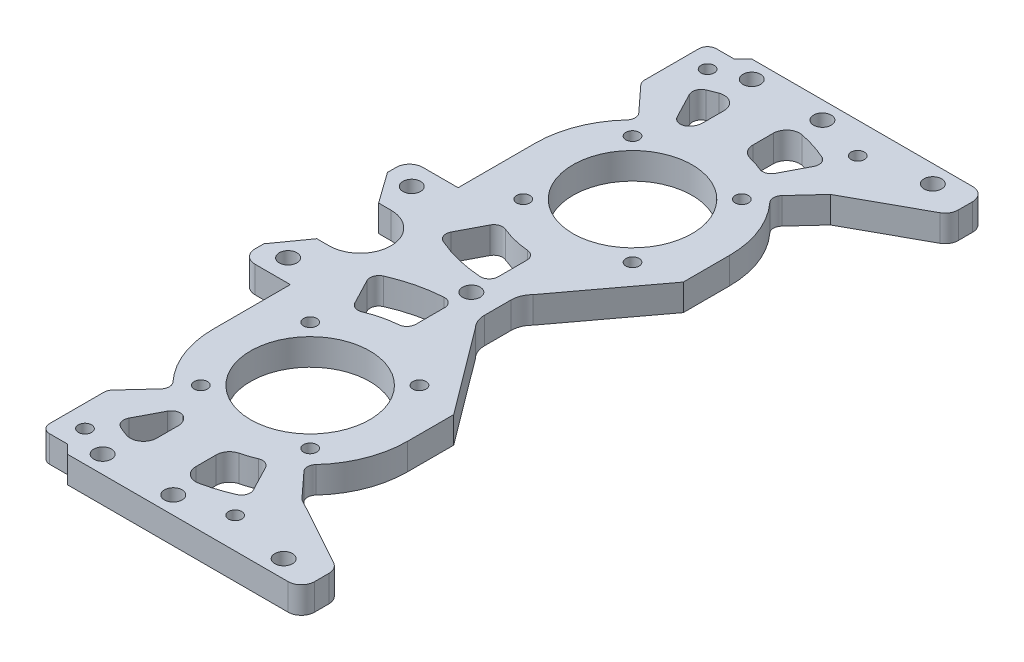
from build123d import *
from build123d.topology import SkipClean

# Parameters (mm, degrees)
SKETCH_1_W           = 44
SKETCH_1_H           = 131
SKETCH_1_R           = 1.6000000000000012
SKETCH_1_R_2         = 1.5999999999999979
SKETCH_1_R_3         = 1.5999999999999954
SKETCH_1_R_4         = 1.5999999999999988
SKETCH_1_H_2         = 9.999999999999986
SKETCH_1_R_5         = 1.600000000000003
SKETCH_1_R_6         = 1.600000000000006
EXTRUDE_1_DEPTH      = 6
SKETCH_2_R           = 2.300000000007249
EXTRUDE_2_DEPTH      = 6
CUT_EXTRUDE_1_DEPTH  = 6
FILLET_1_R           = 5
CUT_EXTRUDE_2_DEPTH  = 6
FILLET_2_R           = 2
SKETCH_4_R           = 1.5999999999999954
SKETCH_4_R_2         = 1.5999999999999985
SKETCH_4_R_3         = 1.5999999999999968
EXTRUDE_3_DEPTH      = 6
SKETCH_5_R           = 1.5000000000000044
EXTRUDE_4_DEPTH      = 6
CUT_EXTRUDE_3_DEPTH  = 6
EXTRUDE_5_DEPTH      = 6
CUT_EXTRUDE_4_DEPTH  = 10
CHAMFER_1_SIZE       = 4
CUT_EXTRUDE_5_DEPTH  = 10
SKETCH_8_R           = 7
CUT_EXTRUDE_6_DEPTH  = 10
SKETCH_11_R          = 2.100000000000002
EXTRUDE_6_DEPTH      = 6
SKETCH_9_R           = 7.499999999999999
CUT_EXTRUDE_7_DEPTH  = 10
CUT_EXTRUDE_8_DEPTH  = 10
CUT_EXTRUDE_START    = -10
CUT_EXTRUDE_9_DEPTH  = 10
FILLET_3_R           = 2
CUT_EXTRUDE_10_DEPTH = 10
SKETCH_14_R          = 2.1
CUT_EXTRUDE_11_DEPTH = 10
EXTRUDE_7_DEPTH      = 6
FILLET_4_R           = 3
FILLET_5_R           = 3
SKETCH_17_R          = 2.1
SKETCH_17_R_2        = 2
SKETCH_17_R_3        = 2.3000000000072487
SKETCH_17_R_4        = 1.9999999999999996
SKETCH_17_R_5        = 1.5999999999999968
SKETCH_17_R_6        = 1.4999999999999991
SKETCH_17_R_7        = 1.5999999999999985
SKETCH_17_R_8        = 1.5000000000000009
SKETCH_17_R_9        = 1.5999999999999974
SKETCH_17_R_10       = 1.6000000000000043
SKETCH_17_R_11       = 2.1000000000000085
SKETCH_17_R_12       = 1.9999999999999936
SKETCH_17_R_13       = 1.600000000000006
SKETCH_17_R_14       = 2.100000000000005
SKETCH_17_R_15       = 2.0999999999999988
SKETCH_17_R_16       = 2.100000000000012
SKETCH_17_R_17       = 1.6000000000000394
SKETCH_17_R_18       = 2.100000000000027
SKETCH_17_R_19       = 1.6000000000000376
SKETCH_17_R_20       = 1.6000000000000276
SKETCH_17_R_21       = 1.6000000000000207
SKETCH_17_R_22       = 1.6000000000000105
SKETCH_17_R_23       = 1.6000000000000045
SKETCH_17_R_24       = 2.3000000000120995
EXTRUDE_8_DEPTH      = 6


with BuildPart() as part:
    # 草图1 → 凸台-拉伸1 (new body)
    # profile 1 of 3: a face of its own
    with BuildSketch(Plane(origin=(0, 0, 0), x_dir=(1, 0, 0), z_dir=(0, 1, 0))):
        Rectangle(SKETCH_1_W, SKETCH_1_H)
        with Locations(Location((-12.374368670764605, -48.874368670764554, 0), (0, 0, 270))):
            Circle(SKETCH_1_R, mode=Mode.SUBTRACT)
        with Locations(Location((-12.374368670764358, -24.125631329235514, 0), (0, 0, 270))):
            Circle(SKETCH_1_R_2, mode=Mode.SUBTRACT)
        with Locations(Location((12.374368670764607, -48.874368670764895, 0), (0, 0, 270))):
            Circle(SKETCH_1_R_3, mode=Mode.SUBTRACT)
        with BuildLine():
            ThreePointArc((13.5, -36.5), (-9.545941546018376, -46.045941546018405), (-3.814e-14, -23))
            ThreePointArc((-3.814e-14, -23), (9.545941546018378, -26.954058453981595), (13.5, -36.5))
        make_face(mode=Mode.SUBTRACT)
        with Locations(Location((12.374368670764863, -24.125631329235695, 0), (0, 0, 270))):
            Circle(SKETCH_1_R_4, mode=Mode.SUBTRACT)
        with Locations(Location((-12.374368670764358, 24.125631329235514, 0), (0, 0, 270))):
            Circle(SKETCH_1_R_2, mode=Mode.SUBTRACT)
        with Locations(Location((-12.374368670764605, 48.874368670764554, 0), (0, 0, 270))):
            Circle(SKETCH_1_R, mode=Mode.SUBTRACT)
        with BuildLine():
            ThreePointArc((13.5, 36.5), (9.545941546018373, 26.954058453981588), (-5.044e-14, 23))
            ThreePointArc((-5.044e-14, 23), (-9.545941546018375, 46.04594154601841), (13.5, 36.5))
        make_face(mode=Mode.SUBTRACT)
        with Locations(Location((12.374368670764863, 24.125631329235695, 0), (0, 0, 270))):
            Circle(SKETCH_1_R_4, mode=Mode.SUBTRACT)
        with Locations(Location((12.374368670764607, 48.874368670764895, 0), (0, 0, 270))):
            Circle(SKETCH_1_R_3, mode=Mode.SUBTRACT)
    # profile 2 of 3: a face of its own
    with BuildSketch(Plane(origin=(0, 0, 0), x_dir=(1, 0, 0), z_dir=(0, 1, 0))):
        with Locations((0, 70.5)):
            Rectangle(SKETCH_1_W, SKETCH_1_H_2)
        with Locations(Location((-16.999999999999996, 70.5, 0), (0, 0, 270))):
            Circle(SKETCH_1_R_5, mode=Mode.SUBTRACT)
        with Locations(Location((16.999999999999996, 70.5, 0), (0, 0, 270))):
            Circle(SKETCH_1_R_6, mode=Mode.SUBTRACT)
    # profile 3 of 3: a face of its own
    with BuildSketch(Plane(origin=(0, 0, 0), x_dir=(1, 0, 0), z_dir=(0, 1, 0))):
        with Locations((0, -70.5)):
            Rectangle(SKETCH_1_W, SKETCH_1_H_2)
        with Locations(Location((-16.999999999999996, -70.5, 0), (0, 0, 270))):
            Circle(SKETCH_1_R_5, mode=Mode.SUBTRACT)
        with Locations(Location((16.999999999999996, -70.5, 0), (0, 0, 270))):
            Circle(SKETCH_1_R_6, mode=Mode.SUBTRACT)
    extrude(amount=EXTRUDE_1_DEPTH)

    # 草图2 → 凸台-拉伸2 (add)
    with BuildSketch(Plane.XZ):
        Polygon((-21.999999999999996, -19.000000000000007), (-22, 0), (-22, 18.999999999999993), (-33, 18.999999999999996), (-32.99999999999999, -19.00000000000001), align=None)
        with Locations(Location((-27.499999999996053, -13.999999999991697, 0), (0, 0, 270))):
            Circle(SKETCH_2_R, mode=Mode.SUBTRACT)
        with Locations(Location((-27.499999999996067, 14.000000000008303, 0), (0, 0, 270))):
            Circle(SKETCH_2_R, mode=Mode.SUBTRACT)
    extrude(amount=-EXTRUDE_2_DEPTH)

    # 草图2<3> → 切除-拉伸1 (cut)
    with BuildSketch(Plane.XZ):
        Polygon((5.999999999999998, 7.999999999999997), (5.999999999999998, -2.35e-15), (22, 0), (22, 8.000000000000002), align=None)
        Polygon((22, 0), (5.9999999999999964, 0), (5.999999999999999, -8.000000000000002), (22, -8.000000000000002), align=None)
    extrude(amount=-CUT_EXTRUDE_1_DEPTH, mode=Mode.SUBTRACT)

    # 圆角1
    fillet_1_edges = [part.edges().sort_by_distance(p)[0] for p in [
        (5.999999999999999, 3, -8.000000000000002),
        (5.999999999999999, 3, 7.999999999999998),
        (22, 3, 8.000000000000002),
        (22, 3, -8.000000000000002),
    ]]
    fillet(fillet_1_edges, radius=FILLET_1_R)

    # 草图3 → 切除-拉伸2 (cut)
    with BuildSketch(Plane.XZ):
        with BuildLine():
            ThreePointArc((-22, 36.5), (-20.144860004859353, 45.34220647715366), (-14.892307692307439, 52.69318287421101))
            Line((-14.892307692307686, 52.69318287421078), (-21.999999999999993, 60.42174742781138))
            Line((-22, 60.42174742781138), (-22, 36.49999999999999))
        make_face()
        with BuildLine():
            Line((-15.05896435190986, 65.30065264274246), (-10.193760484369747, 55.99582640431797))
            ThreePointArc((-10.193760484369832, 55.995826404317924), (1.35e-15, 58.5), (10.19376048436984, 55.995826404317924))
            Line((10.193760484369749, 55.99582640431797), (15.05896435190986, 65.30065264274246))
            ThreePointArc((15.058964351909855, 65.30065264274245), (1.99e-15, 69), (-15.058964351909852, 65.30065264274246))
        make_face()
        with BuildLine():
            Line((22, 60.42174742781138), (14.89230769230769, 52.69318287421078))
            ThreePointArc((14.89230769230745, 52.693182874211), (20.144860004859353, 45.34220647715365), (22, 36.5))
            Line((22, 36.5), (22, 60.42174742781138))
        make_face()
        with BuildLine():
            Line((-22, -36.50000000000003), (-22, -60.4217474278114))
            Line((-21.999999999999982, -60.4217474278114), (-14.892307692307668, -52.693182874210784))
            ThreePointArc((-14.892307692307435, -52.69318287421101), (-20.14486000485934, -45.34220647715367), (-21.999999999999986, -36.500000000000014))
        make_face()
        with BuildLine():
            ThreePointArc((-15.05896435190985, -65.30065264274245), (7.91e-15, -69), (15.058964351909868, -65.30065264274246))
            Line((15.058964351909875, -65.30065264274249), (10.193760484369765, -55.995826404317995))
            ThreePointArc((10.193760484369836, -55.99582640431795), (9.84e-15, -58.500000000000014), (-10.193760484369815, -55.995826404317945))
            Line((-10.193760484369738, -55.995826404317995), (-15.058964351909848, -65.30065264274249))
        make_face()
        with BuildLine():
            Line((14.892307692307709, -52.69318287421079), (22.000000000000014, -60.42174742781138))
            Line((22, -60.42174742781138), (22, -36.500000000000014))
            ThreePointArc((22.000000000000014, -36.50000000000002), (20.144860004859343, -45.34220647715373), (14.89230769230737, -52.6931828742111))
        make_face()
    extrude(amount=-CUT_EXTRUDE_2_DEPTH, mode=Mode.SUBTRACT)

    # 圆角2
    fillet_2_edges = [part.edges().sort_by_distance(p)[0] for p in [
        (14.892307692307567, 3, 52.69318287421088),
        (22, 3, 60.42174742781138),
        (10.193760484369793, 3, 55.995826404317945),
        (-10.19376048436979, 3, 55.995826404317945),
        (-15.058964351909859, 3, 65.30065264274246),
        (15.058964351909859, 3, 65.30065264274245),
        (15.058964351909871, 3, -65.30065264274248),
        (-15.058964351909848, 3, -65.30065264274248),
        (-10.193760484369776, 3, -55.99582640431797),
        (10.1937604843698, 3, -55.995826404317974),
        (-14.892307692307549, 3, -52.69318287421089),
        (-21.999999999999993, 3, -60.4217474278114),
        (22.000000000000007, 3, -60.42174742781138),
        (14.892307692307536, 3, -52.69318287421095),
        (-14.892307692307563, 3, 52.6931828742109),
        (-21.999999999999996, 3, 60.42174742781138),
        (-22, 3, -75.49999999999999),
        (22, 3, -75.49999999999999),
        (22, 3, 75.49999999999999),
        (-22, 3, 75.49999999999999),
    ]]
    fillet(fillet_2_edges, radius=FILLET_2_R)

    # 草图4 → 凸台-拉伸3 (add)
    with BuildSketch(Plane.XZ):
        Polygon((-32.99999999999999, -30), (-32.99999999999999, 29.999999999999993), (-55, 29.999999999999993), (-55, -30.000000000000007), align=None)
        with Locations(Location((-37.99999999999999, 24.999999999999993, 0), (0, 0, 270))):
            Circle(SKETCH_4_R, mode=Mode.SUBTRACT)
        with Locations(Location((-50, -25.000000000000007, 0), (0, 0, 270))):
            Circle(SKETCH_4_R_2, mode=Mode.SUBTRACT)
        with Locations(Location((-38.00000000000001, -25.000000000000007, 0), (0, 0, 270))):
            Circle(SKETCH_4_R_3, mode=Mode.SUBTRACT)
        with Locations(Location((-50, 24.999999999999993, 0), (0, 0, 270))):
            Circle(SKETCH_4_R_2, mode=Mode.SUBTRACT)
    extrude(amount=-EXTRUDE_3_DEPTH)

    # 草图5 → 凸台-拉伸4 (add)
    with BuildSketch(Plane.XZ):
        Polygon((-55, 14.999999999999984), (-65.19999999998896, 14.999999999999984), (-65.19999999998896, -15.000000000000009), (-55, -15.00000000000001), align=None)
        with Locations(Location((-61.19999999998895, -10.000000000000016, 0), (0, 0, 270))):
            Circle(SKETCH_5_R, mode=Mode.SUBTRACT)
        with Locations(Location((-61.19999999998895, 9.999999999999991, 0), (0, 0, 270))):
            Circle(SKETCH_5_R, mode=Mode.SUBTRACT)
    extrude(amount=-EXTRUDE_4_DEPTH)

    # 草图5<4> → 切除-拉伸3 (cut)
    with BuildSketch(Plane.XZ):
        with BuildLine():
            ThreePointArc((-33.99999999998895, 9.999999999999986), (-33.56066017176877, 8.939339828220156), (-32.49999999998893, 8.499999999999986))
            Line((-32.49999999998895, 8.499999999999986), (-32.49999999998895, 9.999999999999986))
            Line((-32.49999999998895, 9.999999999999986), (-33.99999999998895, 9.999999999999986))
        make_face()
        with BuildLine():
            Line((-32.49999999998895, 9.999999999999986), (-32.49999999998895, 8.499999999999986))
            ThreePointArc((-32.49999999998893, 8.499999999999986), (-31.43933982820912, 8.93933982822017), (-30.99999999998895, 9.999999999999986))
            ThreePointArc((-30.99999999998895, 9.999999999999986), (-32.49999999998895, 11.499999999999986), (-33.99999999998895, 9.999999999999986))
            Line((-33.99999999998895, 9.999999999999986), (-32.49999999998895, 9.999999999999986))
        make_face()
        with BuildLine():
            ThreePointArc((-30.999999999988944, -10.000000000000012), (-31.439339828209114, -8.939339828220199), (-32.49999999998892, -8.50000000000001))
            Line((-32.499999999988944, -8.50000000000001), (-32.499999999988944, -10.000000000000014))
            Line((-32.499999999988944, -10.000000000000012), (-33.999999999988944, -10.000000000000012))
            ThreePointArc((-33.999999999988944, -10.000000000000012), (-32.499999999988944, -11.500000000000014), (-30.999999999988944, -10.000000000000012))
        make_face()
        with BuildLine():
            Line((-32.499999999988944, -10.000000000000014), (-32.499999999988944, -8.50000000000001))
            ThreePointArc((-32.49999999998892, -8.50000000000001), (-33.56066017176876, -8.939339828220183), (-33.999999999988944, -10.000000000000012))
            Line((-33.999999999988944, -10.000000000000012), (-32.499999999988944, -10.000000000000012))
        make_face()
    extrude(amount=-CUT_EXTRUDE_3_DEPTH, mode=Mode.SUBTRACT)

    # 草图6 → 凸台-拉伸5 (add)
    with BuildSketch(Plane(origin=(0, 6, 0), x_dir=(1, 0, 0), z_dir=(0, 1, 0))):
        with BuildLine():
            Line((-12, 77.49999999999999), (-12, 75.49999999999999))
            Line((-12, 75.49999999999999), (-10.640312423743215, 75.49999999999999))
            ThreePointArc((-10.640312423743223, 75.50000000000004), (-9.999999999999943, 75.60000000000002), (-9.35968757625667, 75.5))
            Line((-9.359687576256672, 75.49999999999999), (5.359687576256704, 75.49999999999999))
            ThreePointArc((5.359687576256699, 75.50000000000001), (6.000000000000013, 75.60000000000002), (6.640312423743326, 75.5))
            Line((6.640312423743325, 75.49999999999999), (12, 75.49999999999999))
            Line((12, 75.49999999999999), (12, 77.49999999999999))
            Line((12, 77.49999999999999), (-12, 77.49999999999999))
        make_face()
        with BuildLine():
            Line((11.999999999999973, -77.49999999999999), (11.999999999999973, -75.49999999999999))
            Line((11.999999999999972, -75.49999999999999), (6.6403124237433, -75.49999999999999))
            ThreePointArc((6.640312423743301, -75.5), (5.999999999999985, -75.60000000000002), (5.35968757625667, -75.50000000000001))
            Line((5.359687576256675, -75.49999999999999), (-9.359687576256718, -75.49999999999999))
            ThreePointArc((-9.359687576256716, -75.5), (-10.000000000000162, -75.60000000000002), (-10.640312423743598, -75.49999999999993))
            Line((-10.640312423743605, -75.49999999999999), (-12.000000000000043, -75.49999999999999))
            Line((-12.000000000000043, -75.49999999999999), (-12.000000000000043, -77.49999999999999))
            Line((-12.000000000000043, -77.49999999999999), (11.999999999999972, -77.49999999999999))
        make_face()
    extrude(amount=-EXTRUDE_5_DEPTH)

    # 草图6<3> → 切除-拉伸4 (cut)
    with SkipClean():  # the faces are left unmerged after this step: merging them gives an invalid solid
        with BuildSketch(Plane(origin=(0, 6, 0), x_dir=(1, 0, 0), z_dir=(0, 1, 0))):
            with BuildLine():
                ThreePointArc((-10.640312423743598, -75.49999999999993), (-10.000000000000162, -75.60000000000002), (-9.359687576256716, -75.5))
                Line((-9.359687576256718, -75.49999999999999), (-10.640312423743605, -75.49999999999999))
            make_face()
            with BuildLine():
                Line((-10.640312423743605, -75.49999999999999), (-9.359687576256718, -75.49999999999999))
                ThreePointArc((-9.359687576256716, -75.5), (-8.303731140140114, -74.73801129036433), (-7.900000000000038, -73.50000000000001))
                ThreePointArc((-7.900000000000038, -73.50000000000001), (-11.23801129036426, -71.80373114014002), (-10.640312423743598, -75.49999999999993))
            make_face()
            with BuildLine():
                ThreePointArc((5.35968757625667, -75.50000000000001), (5.999999999999985, -75.60000000000002), (6.640312423743301, -75.5))
                Line((6.6403124237433, -75.49999999999999), (5.359687576256675, -75.49999999999999))
            make_face()
            with BuildLine():
                Line((5.359687576256675, -75.49999999999999), (6.6403124237433, -75.49999999999999))
                ThreePointArc((6.640312423743301, -75.5), (7.696268859859903, -74.73801129036433), (8.09999999999998, -73.50000000000001))
                ThreePointArc((8.09999999999998, -73.50000000000001), (4.76198870963565, -71.80373114014009), (5.35968757625667, -75.50000000000001))
            make_face()
            with BuildLine():
                ThreePointArc((6.640312423743326, 75.5), (6.000000000000013, 75.60000000000002), (5.359687576256699, 75.50000000000001))
                Line((5.359687576256704, 75.49999999999999), (6.640312423743325, 75.49999999999999))
            make_face()
            with BuildLine():
                Line((6.640312423743325, 75.49999999999999), (5.359687576256704, 75.49999999999999))
                ThreePointArc((5.359687576256699, 75.50000000000001), (4.761988709635677, 71.80373114014009), (8.100000000000007, 73.50000000000001))
                ThreePointArc((8.100000000000007, 73.50000000000001), (7.696268859859931, 74.73801129036433), (6.640312423743326, 75.5))
            make_face()
            with BuildLine():
                ThreePointArc((-9.35968757625667, 75.5), (-9.999999999999943, 75.60000000000002), (-10.640312423743223, 75.50000000000004))
                Line((-10.640312423743215, 75.49999999999999), (-9.359687576256672, 75.49999999999999))
            make_face()
            with BuildLine():
                Line((-9.359687576256672, 75.49999999999999), (-10.640312423743215, 75.49999999999999))
                ThreePointArc((-10.640312423743223, 75.50000000000004), (-11.238011290364359, 71.80373114014012), (-7.899999999999995, 73.50000000000001))
                ThreePointArc((-7.899999999999995, 73.50000000000001), (-8.30373114014007, 74.73801129036433), (-9.35968757625667, 75.5))
            make_face()
        extrude(amount=-CUT_EXTRUDE_4_DEPTH, mode=Mode.SUBTRACT)

    # 倒角1
    # the kernel refuses this chamfer: 4 mm, written as the material it adds along each edge
    with BuildSketch(Plane(origin=(-12, 6, -75.49999999999999), x_dir=(-1, 0, 0), z_dir=(0, -1, 0))) as chamfer_1_piece_1_section:
        Polygon((CHAMFER_1_SIZE, 0), (0, CHAMFER_1_SIZE), (0, 0), align=None)
    chamfer_1_piece_1 = extrude(amount=6, mode=Mode.PRIVATE)
    chamfer_1_piece_1 = split(chamfer_1_piece_1, bisect_by=Plane(origin=(-12, 6, -77.49999999999999), z_dir=(0, 0, 1)), keep=Keep.TOP, mode=Mode.PRIVATE)
    add(chamfer_1_piece_1)
    with BuildSketch(Plane(origin=(12, 6, -75.49999999999999), x_dir=(0, 0, -1), z_dir=(0, -1, 0))) as chamfer_1_piece_2_section:
        Polygon((CHAMFER_1_SIZE, 0), (0, CHAMFER_1_SIZE), (0, 0), align=None)
    chamfer_1_piece_2 = extrude(amount=6, mode=Mode.PRIVATE)
    chamfer_1_piece_2 = split(chamfer_1_piece_2, bisect_by=Plane(origin=(12, 6, -77.49999999999999), z_dir=(0, 0, 1)), keep=Keep.TOP, mode=Mode.PRIVATE)
    add(chamfer_1_piece_2)
    with BuildSketch(Plane(origin=(11.999999999999972, 6, 75.49999999999999), x_dir=(4.4e-16, 0, 1), z_dir=(0, -1, 0))) as chamfer_1_piece_3_section:
        Polygon((CHAMFER_1_SIZE, 0), (1.78e-15, -CHAMFER_1_SIZE), (0, 0), align=None)
    chamfer_1_piece_3 = extrude(amount=6, mode=Mode.PRIVATE)
    chamfer_1_piece_3 = split(chamfer_1_piece_3, bisect_by=Plane(origin=(11.999999999999972, 6, 77.49999999999999), z_dir=(0, 0, -1)), keep=Keep.TOP, mode=Mode.PRIVATE)
    add(chamfer_1_piece_3)
    with BuildSketch(Plane(origin=(-12.000000000000043, 6, 75.49999999999999), x_dir=(-1, 0, 0), z_dir=(0, -1, 0))) as chamfer_1_piece_4_section:
        Polygon((CHAMFER_1_SIZE, 0), (0, -CHAMFER_1_SIZE), (0, 0), align=None)
    chamfer_1_piece_4 = extrude(amount=6, mode=Mode.PRIVATE)
    chamfer_1_piece_4 = split(chamfer_1_piece_4, bisect_by=Plane(origin=(-12.000000000000043, 6, 77.49999999999999), z_dir=(0, 0, -1)), keep=Keep.TOP, mode=Mode.PRIVATE)
    add(chamfer_1_piece_4)

    # 草图7 → 切除-拉伸5 (cut)
    with BuildSketch(Plane(origin=(0, 6, 0), x_dir=(1, 0, 0), z_dir=(0, 1, 0))):
        Polygon((-25.19999999998896, 7.000000000000005), (-65.19999999998896, 7), (-65.19999999998896, -7), (-25.19999999998896, -6.999999999999996), align=None)
    extrude(amount=-CUT_EXTRUDE_5_DEPTH, mode=Mode.SUBTRACT)

    # 草图8 → 切除-拉伸6 (cut)
    with BuildSketch(Plane(origin=(0, 6, 0), x_dir=(1, 0, 0), z_dir=(0, 1, 0))):
        with Locations((-25.19999999998896, 4.34e-15)):
            Circle(SKETCH_8_R)
    extrude(amount=-CUT_EXTRUDE_6_DEPTH, mode=Mode.SUBTRACT)

    # 草图11 → 凸台-拉伸6 (add)
    # profile 1 of 2: a face of its own
    with BuildSketch(Plane(origin=(0, 6, 0), x_dir=(1, 0, 0), z_dir=(0, 1, 0))):
        with BuildLine():
            Line((21.47210753401916, 59.847742416891464), (39.00000000000001, 69.49999999999997))
            Line((39.00000000000001, 69.49999999999997), (39.00000000000001, 77.49999999999999))
            Line((39.00000000000001, 77.49999999999999), (14.00000000000005, 77.49999999999999))
            Line((14.00000000000005, 77.49999999999999), (14.00000000000005, 69.5))
            Line((14.00000000000005, 69.5), (15.751000400320294, 69.5))
            ThreePointArc((15.751000400320303, 69.50000000000001), (16.999999999999975, 72.10000000000001), (18.248999599679713, 69.50000000000004))
            Line((18.248999599679728, 69.5), (22, 69.49999999999999))
            Line((22, 69.5), (22, 61.201588570737606))
            ThreePointArc((22, 61.201588570737606), (21.8633592069215, 60.47502648393371), (21.47210753401916, 59.847742416891464))
        make_face()
        with Locations(Location((31.000000000000004, 73.50000000000001, 0), (0, 0, 270))):
            Circle(SKETCH_11_R, mode=Mode.SUBTRACT)
    # profile 2 of 2: a face of its own
    with BuildSketch(Plane(origin=(0, 6, 0), x_dir=(1, 0, 0), z_dir=(0, 1, 0))):
        with BuildLine():
            Line((21.999999999999993, -61.201588570737606), (21.999999999999986, -69.5))
            Line((21.999999999999986, -69.49999999999999), (18.248999599679728, -69.5))
            ThreePointArc((18.248999599679713, -69.50000000000004), (16.999999999999982, -72.10000000000001), (15.751000400320294, -69.50000000000001))
            Line((15.751000400320292, -69.5), (14.00000000000004, -69.5))
            Line((14.00000000000004, -69.5), (14.000000000000036, -77.49999999999999))
            Line((14.000000000000036, -77.49999999999999), (39.00000000000001, -77.49999999999999))
            Line((39.00000000000001, -77.49999999999999), (39.00000000000001, -69.49999999999997))
            Line((39.00000000000001, -69.49999999999997), (21.47210753401915, -59.847742416891464))
            ThreePointArc((21.47210753401915, -59.847742416891464), (21.86335920692149, -60.47502648393371), (21.999999999999993, -61.201588570737606))
        make_face()
        with Locations(Location((30.99999999999999, -73.50000000000001, 0), (0, 0, 270))):
            Circle(SKETCH_11_R, mode=Mode.SUBTRACT)
    extrude(amount=-EXTRUDE_6_DEPTH)

    # 草图9 → 切除-拉伸7 (cut)
    with BuildSketch(Plane(origin=(0, 6, 0), x_dir=(1, 0, 0), z_dir=(0, 1, 0))):
        with Locations((22, -8)):
            Circle(SKETCH_9_R)
        with Locations((22, 8)):
            Circle(SKETCH_9_R)
    extrude(amount=-CUT_EXTRUDE_7_DEPTH, mode=Mode.SUBTRACT)

    # 草图10 → 切除-拉伸8 (cut)
    with BuildSketch(Plane(origin=(0, 6, 0), x_dir=(1, 0, 0), z_dir=(0, 1, 0))):
        Polygon((-65.19999999998896, -29.999999999999996), (-65.19999999998896, 29.999999999999996), (-32.99999999999999, 30), (-32.99999999999999, -29.999999999999996), align=None)
        Polygon((-32.99999999999999, 14.000000000000004), (-32.99999999999999, -13.999999999999996), (-27.99999999999999, -6.999999999999996), (-27.999999999999993, 7.000000000000005), align=None)
    extrude(amount=-CUT_EXTRUDE_8_DEPTH, mode=Mode.SUBTRACT)

    # 草图12 → 切除-拉伸9 (cut)
    with BuildSketch(Plane(origin=(0, 6, 0), x_dir=(1, 0, 0), z_dir=(0, 1, 0)).offset(CUT_EXTRUDE_START)):
        with BuildLine():
            Line((9.7e-16, 3.9999999999999964), (4.3e-16, 14.500000000000004))
            ThreePointArc((3.5438e-13, 14.500000000000004), (-4.352879350461469, 14.93492542650673), (-8.533651618374918, 16.222505330879585))
            ThreePointArc((-8.53365161837492, 16.222505330879585), (-9.986468243012771, 16.261018674333567), (-11.081785984074282, 15.305802223174965))
            Line((-11.081785984074282, 15.305802223174965), (-14.101842334122514, 9.529867579421293))
            ThreePointArc((-14.101842334122514, 9.529867579421293), (-14.217370431844785, 7.942916378571444), (-13.137985920442516, 6.7738612336843484))
            ThreePointArc((-13.137985920442516, 6.77386123368435), (-6.713810024670839, 4.7010258820724005), (1.78e-15, 4))
        make_face()
        with BuildLine():
            Line((-14.101842334122516, -9.529867579421285), (-11.081785984074285, -15.305802223174958))
            ThreePointArc((-11.081785984074287, -15.305802223174958), (-9.986468243012775, -16.26101867433356), (-8.533651618374924, -16.222505330879578))
            ThreePointArc((-8.533651618374922, -16.22250533087958), (-4.352879350461469, -14.934925426506727), (3.5483e-13, -14.500000000000004))
            Line((-8.9e-16, -14.500000000000004), (-1.99e-15, -3.9999999999999893))
            ThreePointArc((0, -3.999999999999993), (-6.713810024670839, -4.701025882072393), (-13.137985920442517, -6.773861233684343))
            ThreePointArc((-13.137985920442517, -6.773861233684341), (-14.217370431844785, -7.942916378571437), (-14.101842334122516, -9.529867579421285))
        make_face()
    extrude(amount=CUT_EXTRUDE_9_DEPTH, mode=Mode.SUBTRACT)

    # 圆角3
    fillet_3_edges = [part.edges().sort_by_distance(p)[0] for p in [
        (1.7741e-13, 3, -14.500000000000002),
        (9.3e-16, 3, -3.9999999999999982),
        (-1e-15, 3, 3.999999999999991),
        (1.7797e-13, 3, 14.500000000000004),
    ]]
    fillet(fillet_3_edges, radius=FILLET_3_R)

    # 草图13 → 切除-拉伸10 (cut)
    with BuildSketch(Plane(origin=(0, 6, 0), x_dir=(1, 0, 0), z_dir=(0, 1, 0))):
        with BuildLine():
            Line((7.464466094067261, 6.5355339059327395), (22, 26.000000000000007))
            Line((22, 26.000000000000007), (22, -26))
            Line((22, -26), (7.4644660940672605, -6.535533905932737))
            ThreePointArc((7.4644660940672605, -6.535533905932737), (6.380602337443563, -4.913417161825446), (5.999999999999998, -2.999999999999999))
            Line((5.999999999999998, -2.999999999999999), (5.999999999999998, 3.0000000000000018))
            ThreePointArc((5.999999999999998, 3.0000000000000018), (6.380602337443565, 4.913417161825452), (7.464466094067261, 6.5355339059327395))
        make_face()
    extrude(amount=-CUT_EXTRUDE_10_DEPTH, mode=Mode.SUBTRACT)

    # 草图14 → 切除-拉伸11 (cut)
    with BuildSketch(Plane.XZ):
        with Locations(Location((0, 0, 0), (0, 0, 270))):
            Circle(SKETCH_14_R)
    extrude(amount=-CUT_EXTRUDE_11_DEPTH, mode=Mode.SUBTRACT)

    # 草图16 → 凸台-拉伸7 (add)
    with BuildSketch(Plane(origin=(0, 6, 0), x_dir=(1, 0, 0), z_dir=(0, 1, 0))):
        Polygon((3.000000000000001, 77.49999999999999), (-7.000000000000001, 77.49999999999999), (-6.999999999999998, 55.499999999999986), (3.000000000000004, 55.499999999999986), align=None)
        Polygon((-7.000000000000037, -77.49999999999999), (-7.000000000000025, -55.499999999999986), (2.999999999999978, -55.499999999999986), (2.9999999999999636, -77.49999999999999), align=None)
    extrude(amount=-EXTRUDE_7_DEPTH)

    # 圆角4
    # the kernel refuses this fillet: 3 mm, written as the material it adds along each edge
    with BuildSketch(Plane(origin=(3.000000000000002, 6, -68.86124225056881), x_dir=(0.9889750159305115, 0, 0.14808246981072612), z_dir=(0, -1, 0))) as fillet_4_piece_1:
        with BuildLine():
            CenterArc((3.481934557248917, 2.9952653058202774), FILLET_4_R, 171.48418080684652, 101.73525747445501)
            Line((0.5150095094573806, 3.439512715252442), (0, 0))
            ThreePointArc((0, 0), (1.8252076308159657, -0.05129252028039473), (3.650415261631931, 1e-17))
        make_face()
    extrude(amount=6)
    with BuildSketch(Plane(origin=(-6.999999999999998, 6, -68.2372021451167), x_dir=(-4.5e-16, 0, 1), z_dir=(0, -1, 0))) as fillet_4_piece_2:
        with BuildLine():
            CenterArc((3.983823972360882, 3), FILLET_4_R, 160.18507185149306, 109.81492814850691)
            ThreePointArc((1.1614465310636763, 4.016949152542375), (0.5160531224182288, 2.0271730736955695), (0, 0))
            Line((0, 0), (3.983823972360881, 0))
        make_face()
    extrude(amount=6)
    with BuildSketch(Plane(origin=(3.0000000000000036, 6, -58.29449471770339), x_dir=(0, 0, -1), z_dir=(0, -1, 0))) as fillet_4_piece_3:
        with BuildLine():
            CenterArc((2.474827481319835, 3), FILLET_4_R, 193.88654036262892, 76.11345963737108)
            ThreePointArc((-0.43749118256295105, 2.280000000000003), (-0.18864943531983158, 1.14577491353608), (0, 0))
            Line((0, 0), (2.474827481319835, 0))
        make_face()
    extrude(amount=6)
    with BuildSketch(Plane(origin=(-6.999999999999997, 6, -57.35665361461422), x_dir=(-0.9355165636527262, 0, 0.3532828316397426), z_dir=(0, -1, 0))) as fillet_4_piece_4:
        with BuildLine():
            CenterArc((2.086538932486849, 2.966485133421304), FILLET_4_R, 200.68823974678753, 60.73939049658128)
            Line((-0.7200107584713293, 1.906636638502076), (0, 0))
            ThreePointArc((0, 0), (0.8196817020487687, 0.01527525968270757), (1.6393634040973872, 5e-17))
        make_face()
    extrude(amount=6)
    with BuildSketch(Plane(origin=(-7.000000000000026, 6, 57.356653614614196), x_dir=(-4.4e-16, 0, 1), z_dir=(0, -1, 0))) as fillet_4_piece_5:
        with BuildLine():
            CenterArc((2.0380575957497142, 3), FILLET_4_R, 209.26060950341883, 60.73939049658111)
            ThreePointArc((-0.5791589454860493, 1.5336516183792164), (-0.2752892142958029, 0.772222296184416), (0, 0))
            Line((0, 0), (2.038057595749713, 0))
        make_face()
    extrude(amount=6)
    with BuildSketch(Plane(origin=(2.999999999999976, 6, 58.29449471770337), x_dir=(0.9820838764719788, 0, -0.18844431425164032), z_dir=(0, -1, 0))) as fillet_4_piece_6:
        with BuildLine():
            CenterArc((2.4798844618075044, 2.995821109208881), FILLET_4_R, 190.86201006285665, 76.11345963737108)
            Line((-0.4663671676084318, 2.43048816645396), (0, 0))
            ThreePointArc((0, 0), (1.160796982122668, 0.03064519913488969), (2.3215939642453285, 2e-17))
        make_face()
    extrude(amount=6)
    with BuildSketch(Plane(origin=(-7.000000000000032, 6, 68.2372021451167), x_dir=(-0.9606507391599529, 0, -0.2777591714983255), z_dir=(0, -1, 0))) as fillet_4_piece_7:
        with BuildLine():
            CenterArc((3.9884958634379744, 2.9937859292366316), FILLET_4_R, 163.87348951821895, 109.81492814850691)
            Line((1.1065436459581155, 3.8270634437316082), (0, 0))
            ThreePointArc((0, 0), (2.0907437993828095, -0.06731909993650714), (4.181487598765617, 8e-17))
        make_face()
    extrude(amount=6)
    with BuildSketch(Plane(origin=(2.9999999999999694, 6, 68.86124225056881), x_dir=(6.4e-16, 0, -1), z_dir=(0, -1, 0))) as fillet_4_piece_8:
        with BuildLine():
            CenterArc((3.477856022496441, 3), FILLET_4_R, 168.26474252554453, 101.73525747445541)
            ThreePointArc((0.5405625077772266, 3.6101694915254274), (0.21955423282719383, 1.8126802688486559), (0, 0))
            Line((0, 0), (3.4778560224964394, 0))
        make_face()
    extrude(amount=6)
    # the kernel refuses this fillet: 3 mm, written as the material it takes off along each edge
    with BuildSketch(Plane(origin=(39.00000000000001, 10.431893605808988, 69.49999999999997), x_dir=(0, 0, 1), z_dir=(0, -1, 0))) as fillet_4_2_piece_1:
        with BuildLine():
            CenterArc((FILLET_4_R * 0.590919147441, FILLET_4_R), FILLET_4_R, 208.84069211093257, 61.15930788906746)
            Line((-FILLET_4_R * 0.285045164716, FILLET_4_R * 0.517624084529), (0, 0))
            Line((0, 0), (FILLET_4_R * 0.590919147441, 0))
        make_face()
    extrude(amount=14.863787211617975, mode=Mode.SUBTRACT)
    with BuildSketch(Plane(origin=(39.00000000000001, 13.5, 77.49999999999999), x_dir=(-1, 0, 4.74e-15), z_dir=(0, -1, 0))) as fillet_4_2_piece_2:
        with BuildLine():
            CenterArc((FILLET_4_R, FILLET_4_R), FILLET_4_R, 180, 90.00000000000028)
            Line((-1.421e-14, FILLET_4_R), (0, 0))
            Line((0, 0), (FILLET_4_R, 0))
        make_face()
    extrude(amount=21, mode=Mode.SUBTRACT)
    with BuildSketch(Plane(origin=(39.00000000000001, 13.5, -77.49999999999999), x_dir=(0, 0, 1), z_dir=(0, -1, 0))) as fillet_4_2_piece_3:
        with BuildLine():
            CenterArc((FILLET_4_R, FILLET_4_R), FILLET_4_R, 180, 90)
            Line((0, FILLET_4_R), (0, 0))
            Line((0, 0), (FILLET_4_R, 0))
        make_face()
    extrude(amount=21, mode=Mode.SUBTRACT)
    with BuildSketch(Plane(origin=(39.00000000000001, 10.431893605808988, -69.49999999999997), x_dir=(-0.8759643121574832, 0, 0.48237591547098146), z_dir=(0, -1, 0))) as fillet_4_2_piece_4:
        with BuildLine():
            CenterArc((FILLET_4_R * 0.590919147441, FILLET_4_R), FILLET_4_R, 208.8406921109323, 61.15930788906752)
            Line((-FILLET_4_R * 0.285045164716, FILLET_4_R * 0.517624084529), (0, 0))
            Line((0, 0), (FILLET_4_R * 0.590919147441, 0))
        make_face()
    extrude(amount=14.863787211617975, mode=Mode.SUBTRACT)

    # 圆角5
    fillet_5_edges = [part.edges().sort_by_distance(p)[0] for p in [
        (-33, 3, 18.999999999999996),
        (-32.99999999999999, 3, -19.00000000000001),
    ]]
    fillet(fillet_5_edges, radius=FILLET_5_R)

    # 草图17 → 凸台-拉伸8 (add)
    # profile 1 of 21: a face of its own
    with BuildSketch(Plane.XZ):
        Circle(SKETCH_17_R)
        with Locations(Location((0, 0, 0), (0, 0, 270))):
            Circle(SKETCH_17_R_2, mode=Mode.SUBTRACT)
    # profile 2 of 21: a face of its own
    with BuildSketch(Plane.XZ):
        with Locations((-27.499999999996067, 14.000000000008303)):
            Circle(SKETCH_17_R_3)
        with Locations(Location((-27.499999999996067, 14.000000000008303, 0), (0, 0, 270))):
            Circle(SKETCH_17_R_4, mode=Mode.SUBTRACT)
    # profile 3 of 21: a face of its own
    with BuildSketch(Plane.XZ):
        with Locations((12.374368670764863, 24.125631329235695)):
            Circle(SKETCH_17_R_5)
        with Locations(Location((12.374368670764852, 24.125631329235702, 0), (0, 0, 270))):
            Circle(SKETCH_17_R_6, mode=Mode.SUBTRACT)
    # profile 4 of 21: a face of its own
    with BuildSketch(Plane.XZ):
        with Locations((-12.374368670764358, 24.125631329235514)):
            Circle(SKETCH_17_R_7)
        with Locations(Location((-12.374368670764367, 24.12563132923551, 0), (0, 0, 270))):
            Circle(SKETCH_17_R_8, mode=Mode.SUBTRACT)
    # profile 5 of 21: a face of its own
    with BuildSketch(Plane.XZ):
        with Locations((12.374368670764607, 48.874368670764895)):
            Circle(SKETCH_17_R_9)
        with Locations(Location((12.374368670764582, 48.874368670764895, 0), (0, 0, 270))):
            Circle(SKETCH_17_R_8, mode=Mode.SUBTRACT)
    # profile 6 of 21: a face of its own
    with BuildSketch(Plane.XZ):
        with Locations((-12.374368670764605, 48.874368670764554)):
            Circle(SKETCH_17_R_10)
        with Locations(Location((-12.37436867076463, 48.874368670764554, 0), (0, 0, 270))):
            Circle(SKETCH_17_R_6, mode=Mode.SUBTRACT)
    # profile 7 of 21: a face of its own
    with BuildSketch(Plane.XZ):
        with Locations((-16.999999999999996, 70.5)):
            Circle(SKETCH_17_R_10)
        with Locations(Location((-17.000000000000032, 70.5, 0), (0, 0, 270))):
            Circle(SKETCH_17_R_8, mode=Mode.SUBTRACT)
    # profile 8 of 21: a face of its own
    with BuildSketch(Plane.XZ):
        with Locations((30.99999999999999, 73.50000000000001)):
            Circle(SKETCH_17_R_11)
        with Locations(Location((30.999999999999968, 73.50000000000004, 0), (0, 0, 270))):
            Circle(SKETCH_17_R_12, mode=Mode.SUBTRACT)
    # profile 9 of 21: a face of its own
    with BuildSketch(Plane.XZ):
        with Locations((16.999999999999996, 70.5)):
            Circle(SKETCH_17_R_13)
        with Locations(Location((16.999999999999964, 70.5, 0), (0, 0, 270))):
            Circle(SKETCH_17_R_8, mode=Mode.SUBTRACT)
    # profile 10 of 21: a face of its own
    with BuildSketch(Plane.XZ):
        with Locations((5.999999999999974, 73.50000000000001)):
            Circle(SKETCH_17_R_14)
        with Locations(Location((5.999999999999967, 73.50000000000001, 0), (0, 0, 270))):
            Circle(SKETCH_17_R_2, mode=Mode.SUBTRACT)
    # profile 11 of 21: a face of its own
    with BuildSketch(Plane.XZ):
        with Locations((-10.000000000000043, 73.50000000000001)):
            Circle(SKETCH_17_R_14)
        with Locations(Location((-10.000000000000036, 73.50000000000001, 0), (0, 0, 270))):
            Circle(SKETCH_17_R_2, mode=Mode.SUBTRACT)
    # profile 12 of 21: a face of its own
    with BuildSketch(Plane.XZ):
        with Locations((-10, -73.50000000000001)):
            Circle(SKETCH_17_R_15)
        with Locations(Location((-10, -73.50000000000001, 0), (0, 0, 270))):
            Circle(SKETCH_17_R_2, mode=Mode.SUBTRACT)
    # profile 13 of 21: a face of its own
    with BuildSketch(Plane.XZ):
        with Locations((6.000000000000002, -73.50000000000001)):
            Circle(SKETCH_17_R_16)
        with Locations(Location((6.000000000000002, -73.50000000000001, 0), (0, 0, 270))):
            Circle(SKETCH_17_R_2, mode=Mode.SUBTRACT)
    # profile 14 of 21: a face of its own
    with BuildSketch(Plane.XZ):
        with Locations((16.999999999999996, -70.5)):
            Circle(SKETCH_17_R_17)
        with Locations(Location((16.999999999999996, -70.5, 0), (0, 0, 270))):
            Circle(SKETCH_17_R_8, mode=Mode.SUBTRACT)
    # profile 15 of 21: a face of its own
    with BuildSketch(Plane.XZ):
        with Locations((31.000000000000004, -73.50000000000001)):
            Circle(SKETCH_17_R_18)
        with Locations(Location((31.000000000000004, -73.50000000000001, 0), (0, 0, 270))):
            Circle(SKETCH_17_R_2, mode=Mode.SUBTRACT)
    # profile 16 of 21: a face of its own
    with BuildSketch(Plane.XZ):
        with Locations((-16.999999999999996, -70.5)):
            Circle(SKETCH_17_R_19)
        with Locations(Location((-16.999999999999996, -70.5, 0), (0, 0, 270))):
            Circle(SKETCH_17_R_8, mode=Mode.SUBTRACT)
    # profile 17 of 21: a face of its own
    with BuildSketch(Plane.XZ):
        with Locations((-12.374368670764605, -48.874368670764554)):
            Circle(SKETCH_17_R_20)
        with Locations(Location((-12.374368670764605, -48.874368670764554, 0), (0, 0, 270))):
            Circle(SKETCH_17_R_6, mode=Mode.SUBTRACT)
    # profile 18 of 21: a face of its own
    with BuildSketch(Plane.XZ):
        with Locations((12.374368670764607, -48.874368670764895)):
            Circle(SKETCH_17_R_21)
        with Locations(Location((12.374368670764607, -48.874368670764895, 0), (0, 0, 270))):
            Circle(SKETCH_17_R_8, mode=Mode.SUBTRACT)
    # profile 19 of 21: a face of its own
    with BuildSketch(Plane.XZ):
        with Locations((-12.374368670764358, -24.125631329235514)):
            Circle(SKETCH_17_R_22)
        with Locations(Location((-12.374368670764358, -24.125631329235514, 0), (0, 0, 270))):
            Circle(SKETCH_17_R_8, mode=Mode.SUBTRACT)
    # profile 20 of 21: a face of its own
    with BuildSketch(Plane.XZ):
        with Locations((12.374368670764863, -24.125631329235695)):
            Circle(SKETCH_17_R_23)
        with Locations(Location((12.374368670764863, -24.125631329235695, 0), (0, 0, 270))):
            Circle(SKETCH_17_R_6, mode=Mode.SUBTRACT)
    # profile 21 of 21: a face of its own
    with BuildSketch(Plane.XZ):
        with Locations((-27.499999999996053, -13.999999999991697)):
            Circle(SKETCH_17_R_24)
        with Locations(Location((-27.499999999996053, -13.999999999991697, 0), (0, 0, 270))):
            Circle(SKETCH_17_R_4, mode=Mode.SUBTRACT)
    extrude(amount=-EXTRUDE_8_DEPTH)


solid = part.part
